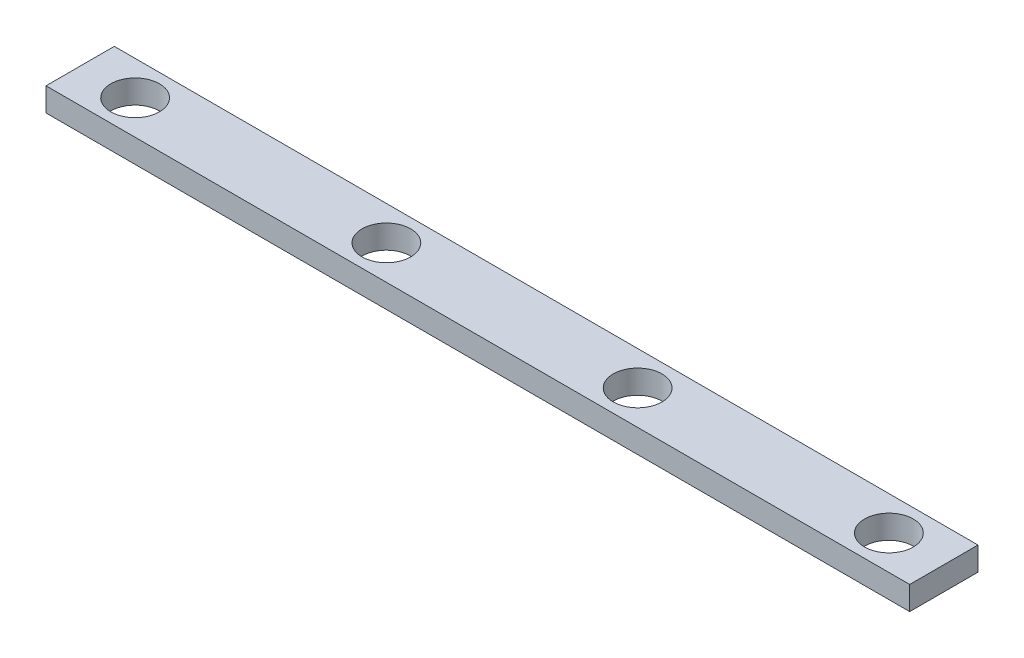
from build123d import *

# Parameters (mm, degrees)
SKETCH2_W           = 110
SKETCH2_H           = 8.7
SKETCH2_R           = 3.1
BOSS_EXTRUDE1_DEPTH = 3


with BuildPart() as part:
    # Sketch2 → Boss-Extrude1 (new body)
    with BuildSketch(Plane(origin=(0, 0, 0), x_dir=(1, 0, 0), z_dir=(0, 1, 0))):
        Rectangle(SKETCH2_W, SKETCH2_H)
        with Locations((48, 0)):
            Circle(SKETCH2_R, mode=Mode.SUBTRACT)
        with Locations((16, 0)):
            Circle(SKETCH2_R, mode=Mode.SUBTRACT)
        with Locations((-16, 0)):
            Circle(SKETCH2_R, mode=Mode.SUBTRACT)
        with Locations((-48, 0)):
            Circle(SKETCH2_R, mode=Mode.SUBTRACT)
    extrude(amount=BOSS_EXTRUDE1_DEPTH)


solid = part.part
